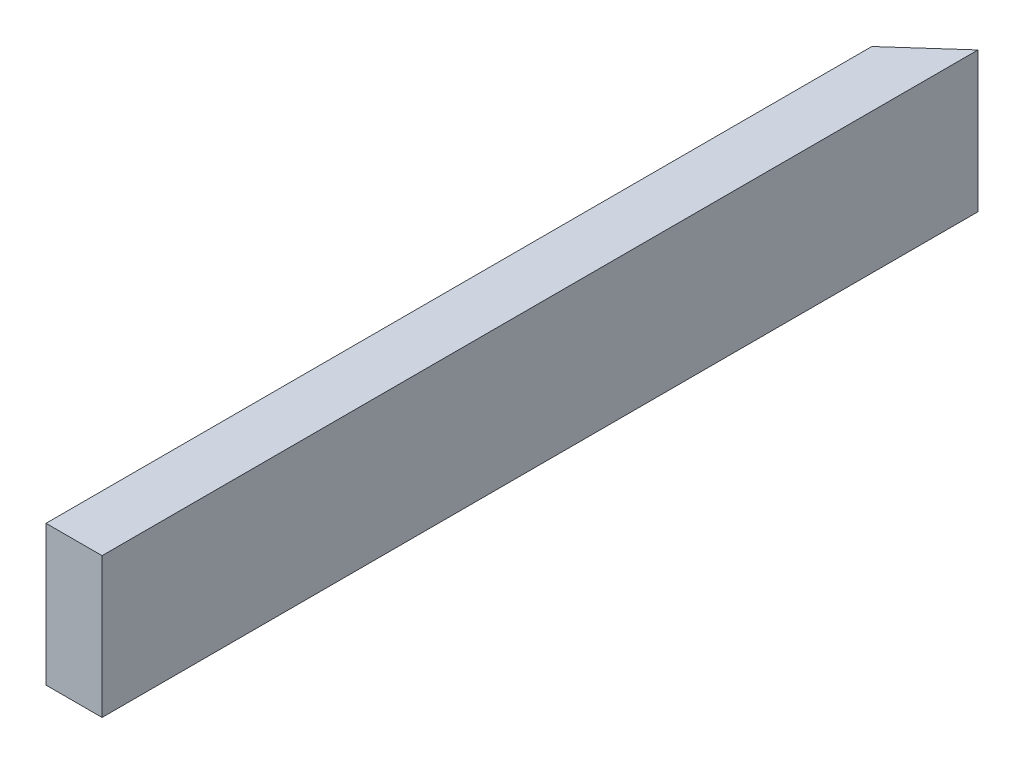
from build123d import *

# Parameters (mm, degrees)
SKETCH1_W           = 3.2
SKETCH1_H           = 8
BOSS_EXTRUDE1_DEPTH = 50
CUT_EXTRUDE1_DEPTH  = 52


with BuildPart() as part:
    # Sketch1 → Boss-Extrude1 (new body)
    with BuildSketch(Plane.XY):
        with Locations((-2.503225806, 8.838709677)):
            Rectangle(SKETCH1_W, SKETCH1_H)
    extrude(amount=BOSS_EXTRUDE1_DEPTH)

    # Sketch3 → Cut-Extrude1 (cut)
    with BuildSketch(Plane(origin=(0, 12.838709677, 0), x_dir=(1, 0, 0), z_dir=(0, 1, 0))):
        Polygon((-0.903225806, 0), (-4.103225806, -2.861130212), (-4.103225806, 0), align=None)
    extrude(amount=-CUT_EXTRUDE1_DEPTH, mode=Mode.SUBTRACT)


solid = part.part
